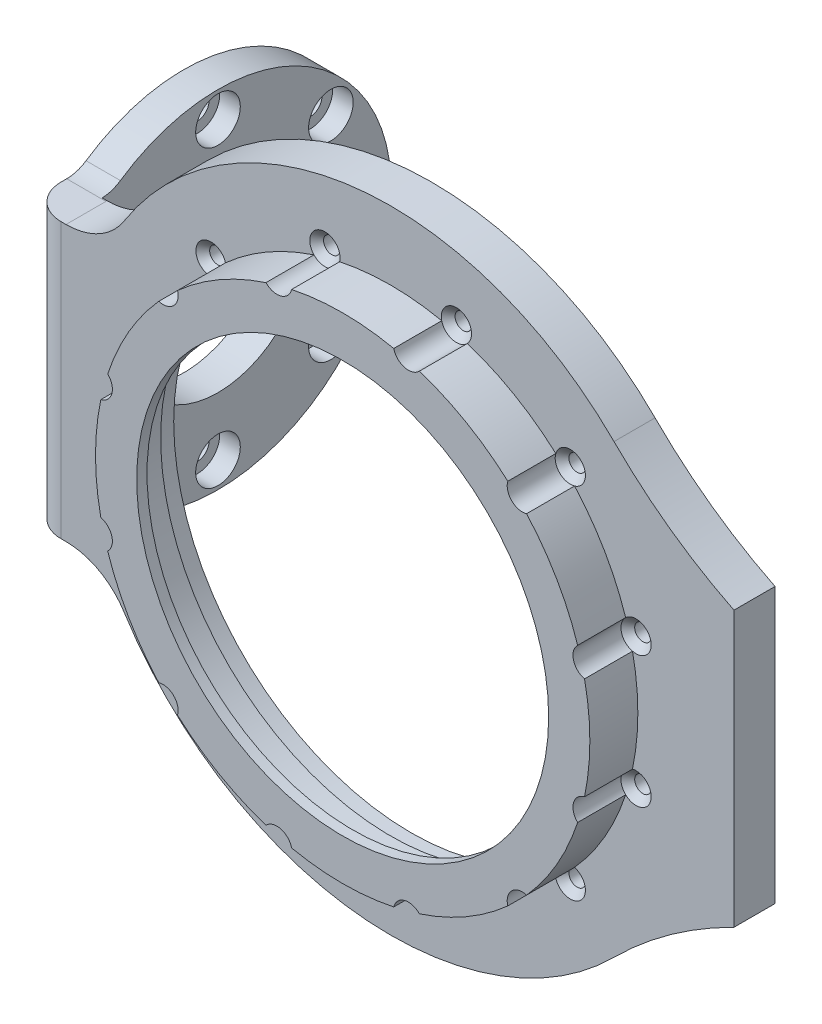
from build123d import *

# Parameters (mm, degrees)
SKETCH_3_R                   = 46
SKETCH_3_R_2                 = 34.6
EXTRUDE_2_DEPTH              = 3
SKETCH_5_R                   = 36
SKETCH_5_R_2                 = 33.5
EXTRUDE_3_DEPTH              = 5.49
EXTRUDE_START                = -2.98
SKETCH_2_R                   = 46
SKETCH_2_R_2                 = 41.6
EXTRUDE_1_DEPTH              = 2.98
SKETCH_6_R                   = 36
SKETCH_6_R_2                 = 30
EXTRUDE_4_DEPTH              = 1.5
EXTRUDE_5_DEPTH              = 3
EXTRUDE_5_DEPTH_BACK         = 2.98
HOLE_WIZARD_M2_1_AT_2_COUNT  = 2
HOLE_WIZARD_M2_1_AT_2_PITCH  = 64.085879878
HOLE_WIZARD_M2_1_AT_3_COUNT  = 2
HOLE_WIZARD_M2_1_AT_3_PITCH  = 71.478511138
HOLE_WIZARD_M2_1_AT_4_COUNT  = 2
HOLE_WIZARD_M2_1_AT_4_PITCH  = 73.999999995
HOLE_WIZARD_M2_1_AT_5_COUNT  = 2
HOLE_WIZARD_M2_1_AT_5_PITCH  = 19.15260934
HOLE_WIZARD_M2_1_AT_6_COUNT  = 2
HOLE_WIZARD_M2_1_AT_6_PITCH  = 36.999999998
HOLE_WIZARD_M2_1_AT_7_COUNT  = 2
HOLE_WIZARD_M2_1_AT_7_PITCH  = 52.325901805
HOLE_WIZARD_M2_1_AT_8_COUNT  = 2
HOLE_WIZARD_M2_1_AT_8_PITCH  = 71.47851114
HOLE_WIZARD_M2_1_AT_9_COUNT  = 2
HOLE_WIZARD_M2_1_AT_9_PITCH  = 64.085879872
HOLE_WIZARD_M2_1_AT_10_COUNT = 2
HOLE_WIZARD_M2_1_AT_10_PITCH = 52.325901805
HOLE_WIZARD_M2_1_AT_11_COUNT = 2
HOLE_WIZARD_M2_1_AT_11_PITCH = 36.999999994
HOLE_WIZARD_M2_1_AT_12_COUNT = 2
HOLE_WIZARD_M2_1_AT_12_PITCH = 19.152609334
CUT_EXTRUDE_1_REACH          = 70.3
SKETCH_13_R                  = 2.2
EXTRUDE_6_DEPTH              = 3
EXTRUDE_6_DEPTH_BACK         = 2
FILLET_1_R                   = 10
FILLET_2_R                   = 10
FILLET_3_R                   = 5
FILLET_4_R                   = 5
FILLET_5_R                   = 5
CUT_EXTRUDE_3_DEPTH          = 119.953814567
CUT_EXTRUDE_3_DEPTH_BACK     = 119.953814567
SKETCH_19_R                  = 13
HOLE_WIZARD_M3_1_AT_2_COUNT  = 2
HOLE_WIZARD_M3_1_AT_2_PITCH  = 18.144210967
HOLE_WIZARD_M3_1_AT_3_COUNT  = 2
HOLE_WIZARD_M3_1_AT_3_PITCH  = 18.144210967
HOLE_WIZARD_M3_1_AT_4_COUNT  = 2
HOLE_WIZARD_M3_1_AT_4_PITCH  = 38.910385988
HOLE_WIZARD_M3_1_AT_5_COUNT  = 2
HOLE_WIZARD_M3_1_AT_5_PITCH  = 42.932860717
HOLE_WIZARD_M3_1_AT_6_COUNT  = 2
HOLE_WIZARD_M3_1_AT_6_PITCH  = 38.910385988
CUT_EXTRUDE_START            = -15
SKETCH_21_R                  = 3.25
CUT_EXTRUDE_4_DEPTH          = 15


with BuildPart() as part:
    # 草图3 → 凸台-拉伸2 (new body)
    with BuildSketch(Plane.XY):
        Circle(SKETCH_3_R)
        Circle(SKETCH_3_R_2, mode=Mode.SUBTRACT)
    extrude(amount=EXTRUDE_2_DEPTH)

    # 草图5 → 凸台-拉伸3 (add)
    with BuildSketch(Plane.XY.offset(3)):
        Circle(SKETCH_5_R)
        Circle(SKETCH_5_R_2, mode=Mode.SUBTRACT)
    extrude(amount=EXTRUDE_3_DEPTH)

    # 草图2 → 凸台-拉伸1 (add)
    with BuildSketch(Plane.XY.offset(EXTRUDE_START)):
        Circle(SKETCH_2_R)
        Circle(SKETCH_2_R_2, mode=Mode.SUBTRACT)
    extrude(amount=EXTRUDE_1_DEPTH)

    # 草图6 → 凸台-拉伸4 (add)
    with BuildSketch(Plane.XY.offset(8.49)):
        Circle(SKETCH_6_R)
        Circle(SKETCH_6_R_2, mode=Mode.SUBTRACT)
    extrude(amount=EXTRUDE_4_DEPTH)

    # 草图8 → 凸台-拉伸5 (add, two sides: drawn at the far end of the back side and taken through both)
    with BuildSketch(Plane.XY.offset(-EXTRUDE_5_DEPTH_BACK)):
        with BuildLine():
            Line((-50, -20), (-50, 20))
            Line((-50, 20), (-41.424630354, 20))
            ThreePointArc((-41.424630354, 20), (-46, 0), (-41.424630354, -20))
            Line((-41.424630354, -20), (-50, -20))
        make_face()
        with BuildLine():
            Line((50, -20), (50, 20))
            ThreePointArc((50, 20), (40.750582015, 25.548076808), (32.526911935, 32.526911935))
            ThreePointArc((32.526911935, 32.526911935), (46, 0), (32.526911935, -32.526911935))
            ThreePointArc((32.526911935, -32.526911935), (40.750582015, -25.548076808), (50, -20))
        make_face()
    extrude(amount=EXTRUDE_5_DEPTH + EXTRUDE_5_DEPTH_BACK)

    # 草图12 → M2 锥坑平头的锥孔1 (revolve, cut)
    with BuildSketch(Plane(origin=(-35.73925557, -9.57630467, 3), x_dir=(0, -1, 0), z_dir=(1, 0, 0))):
        Polygon((0, 0), (0, 5.98), (1.2, 5.98), (1.2, 1), (2.2, 0), align=None)
    hole_wizard_m2_1 = revolve(axis=Axis((-35.73925557, -9.57630467, 9.35), (0, 0, -1)), mode=Mode.SUBTRACT)

    # M2 锥坑平头的锥孔1 at 2: M2 锥坑平头的锥孔1 ×2
    with Locations(*[Vector(0.7071067811865475, 0.7071067811865476, 0) * (i * HOLE_WIZARD_M2_1_AT_2_PITCH) for i in range(1, HOLE_WIZARD_M2_1_AT_2_COUNT)]):
        add(hole_wizard_m2_1, mode=Mode.SUBTRACT)

    # M2 锥坑平头的锥孔1 at 3: M2 锥坑平头的锥孔1 ×2
    with Locations(*[Vector(0.8660254037776919, 0.500000000011686, 0) * (i * HOLE_WIZARD_M2_1_AT_3_PITCH) for i in range(1, HOLE_WIZARD_M2_1_AT_3_COUNT)]):
        add(hole_wizard_m2_1, mode=Mode.SUBTRACT)

    # M2 锥坑平头的锥孔1 at 4: M2 锥坑平头的锥孔1 ×2
    with Locations(*[Vector(0.9659258262760346, 0.2588190451511635, 0) * (i * HOLE_WIZARD_M2_1_AT_4_PITCH) for i in range(1, HOLE_WIZARD_M2_1_AT_4_COUNT)]):
        add(hole_wizard_m2_1, mode=Mode.SUBTRACT)

    # M2 锥坑平头的锥孔1 at 5: M2 锥坑平头的锥孔1 ×2
    with Locations(*[(0, i * HOLE_WIZARD_M2_1_AT_5_PITCH, 0) for i in range(1, HOLE_WIZARD_M2_1_AT_5_COUNT)]):
        add(hole_wizard_m2_1, mode=Mode.SUBTRACT)

    # M2 锥坑平头的锥孔1 at 6: M2 锥坑平头的锥孔1 ×2
    with Locations(*[Vector(0.25881904515116333, 0.9659258262760346, 0) * (i * HOLE_WIZARD_M2_1_AT_6_PITCH) for i in range(1, HOLE_WIZARD_M2_1_AT_6_COUNT)]):
        add(hole_wizard_m2_1, mode=Mode.SUBTRACT)

    # M2 锥坑平头的锥孔1 at 7: M2 锥坑平头的锥孔1 ×2
    with Locations(*[Vector(0.4999999999563881, 0.866025403809618, 0) * (i * HOLE_WIZARD_M2_1_AT_7_PITCH) for i in range(1, HOLE_WIZARD_M2_1_AT_7_COUNT)]):
        add(hole_wizard_m2_1, mode=Mode.SUBTRACT)

    # M2 锥坑平头的锥孔1 at 8: M2 锥坑平头的锥孔1 ×2
    with Locations(*[(i * HOLE_WIZARD_M2_1_AT_8_PITCH, 0, 0) for i in range(1, HOLE_WIZARD_M2_1_AT_8_COUNT)]):
        add(hole_wizard_m2_1, mode=Mode.SUBTRACT)

    # M2 锥坑平头的锥孔1 at 9: M2 锥坑平头的锥孔1 ×2
    with Locations(*[Vector(0.9659258263021021, -0.2588190450538782, 0) * (i * HOLE_WIZARD_M2_1_AT_9_PITCH) for i in range(1, HOLE_WIZARD_M2_1_AT_9_COUNT)]):
        add(hole_wizard_m2_1, mode=Mode.SUBTRACT)

    # M2 锥坑平头的锥孔1 at 10: M2 锥坑平头的锥孔1 ×2
    with Locations(*[Vector(0.8660254038096179, -0.4999999999563883, 0) * (i * HOLE_WIZARD_M2_1_AT_10_PITCH) for i in range(1, HOLE_WIZARD_M2_1_AT_10_COUNT)]):
        add(hole_wizard_m2_1, mode=Mode.SUBTRACT)

    # M2 锥坑平头的锥孔1 at 11: M2 锥坑平头的锥孔1 ×2
    with Locations(*[Vector(0.7071067811865475, -0.7071067811865477, 0) * (i * HOLE_WIZARD_M2_1_AT_11_PITCH) for i in range(1, HOLE_WIZARD_M2_1_AT_11_COUNT)]):
        add(hole_wizard_m2_1, mode=Mode.SUBTRACT)

    # M2 锥坑平头的锥孔1 at 12: M2 锥坑平头的锥孔1 ×2
    with Locations(*[Vector(0.5000000001627614, -0.8660254036904684, 0) * (i * HOLE_WIZARD_M2_1_AT_12_PITCH) for i in range(1, HOLE_WIZARD_M2_1_AT_12_COUNT)]):
        add(hole_wizard_m2_1, mode=Mode.SUBTRACT)

    # 草图13 → 切除-拉伸1 (cut, up to next)
    with BuildSketch(Plane.XY.offset(3), mode=Mode.PRIVATE) as cut_extrude_1_sk1:
        with Locations((-35.73925557, -9.57630467)):
            Circle(SKETCH_13_R)
    cut_extrude_1_tool1 = extrude(cut_extrude_1_sk1.sketch, amount=CUT_EXTRUDE_1_REACH, mode=Mode.PRIVATE) & part.part
    # 草图13 → 切除-拉伸1 (cut, up to next)
    with BuildSketch(Plane.XY.offset(3), mode=Mode.PRIVATE) as cut_extrude_1_sk2:
        with Locations((-26.1629509, -26.1629509)):
            Circle(SKETCH_13_R)
    cut_extrude_1_tool2 = extrude(cut_extrude_1_sk2.sketch, amount=CUT_EXTRUDE_1_REACH, mode=Mode.PRIVATE) & part.part
    # 草图13 → 切除-拉伸1 (cut, up to next)
    with BuildSketch(Plane.XY.offset(3), mode=Mode.PRIVATE) as cut_extrude_1_sk3:
        with Locations((-35.73925557, 9.57630467)):
            Circle(SKETCH_13_R)
    cut_extrude_1_tool3 = extrude(cut_extrude_1_sk3.sketch, amount=CUT_EXTRUDE_1_REACH, mode=Mode.PRIVATE) & part.part
    # 草图13 → 切除-拉伸1 (cut, up to next)
    with BuildSketch(Plane.XY.offset(3), mode=Mode.PRIVATE) as cut_extrude_1_sk4:
        with Locations((-26.1629509, 26.1629509)):
            Circle(SKETCH_13_R)
    cut_extrude_1_tool4 = extrude(cut_extrude_1_sk4.sketch, amount=CUT_EXTRUDE_1_REACH, mode=Mode.PRIVATE) & part.part
    # 草图13 → 切除-拉伸1 (cut, up to next)
    with BuildSketch(Plane.XY.offset(3), mode=Mode.PRIVATE) as cut_extrude_1_sk5:
        with Locations((-9.57630467, 35.73925557)):
            Circle(SKETCH_13_R)
    cut_extrude_1_tool5 = extrude(cut_extrude_1_sk5.sketch, amount=CUT_EXTRUDE_1_REACH, mode=Mode.PRIVATE) & part.part
    # 草图13 → 切除-拉伸1 (cut, up to next)
    with BuildSketch(Plane.XY.offset(3), mode=Mode.PRIVATE) as cut_extrude_1_sk6:
        with Locations((26.1629509, 26.1629509)):
            Circle(SKETCH_13_R)
    cut_extrude_1_tool6 = extrude(cut_extrude_1_sk6.sketch, amount=CUT_EXTRUDE_1_REACH, mode=Mode.PRIVATE) & part.part
    # 草图13 → 切除-拉伸1 (cut, up to next)
    with BuildSketch(Plane.XY.offset(3), mode=Mode.PRIVATE) as cut_extrude_1_sk7:
        with Locations((35.73925557, 9.57630467)):
            Circle(SKETCH_13_R)
    cut_extrude_1_tool7 = extrude(cut_extrude_1_sk7.sketch, amount=CUT_EXTRUDE_1_REACH, mode=Mode.PRIVATE) & part.part
    # 草图13 → 切除-拉伸1 (cut, up to next)
    with BuildSketch(Plane.XY.offset(3), mode=Mode.PRIVATE) as cut_extrude_1_sk8:
        with Locations((35.73925557, -9.57630467)):
            Circle(SKETCH_13_R)
    cut_extrude_1_tool8 = extrude(cut_extrude_1_sk8.sketch, amount=CUT_EXTRUDE_1_REACH, mode=Mode.PRIVATE) & part.part
    # 草图13 → 切除-拉伸1 (cut, up to next)
    with BuildSketch(Plane.XY.offset(3), mode=Mode.PRIVATE) as cut_extrude_1_sk9:
        with Locations((9.57630467, -35.73925557)):
            Circle(SKETCH_13_R)
    cut_extrude_1_tool9 = extrude(cut_extrude_1_sk9.sketch, amount=CUT_EXTRUDE_1_REACH, mode=Mode.PRIVATE) & part.part
    # 草图13 → 切除-拉伸1 (cut, up to next)
    with BuildSketch(Plane.XY.offset(3), mode=Mode.PRIVATE) as cut_extrude_1_sk10:
        with Locations((-9.57630467, -35.73925557)):
            Circle(SKETCH_13_R)
    cut_extrude_1_tool10 = extrude(cut_extrude_1_sk10.sketch, amount=CUT_EXTRUDE_1_REACH, mode=Mode.PRIVATE) & part.part
    # 草图13 → 切除-拉伸1 (cut, up to next)
    with BuildSketch(Plane.XY.offset(3), mode=Mode.PRIVATE) as cut_extrude_1_sk11:
        with Locations((9.57630467, 35.73925557)):
            Circle(SKETCH_13_R)
    cut_extrude_1_tool11 = extrude(cut_extrude_1_sk11.sketch, amount=CUT_EXTRUDE_1_REACH, mode=Mode.PRIVATE) & part.part
    # 草图13 → 切除-拉伸1 (cut, up to next)
    with BuildSketch(Plane.XY.offset(3), mode=Mode.PRIVATE) as cut_extrude_1_sk12:
        with Locations((26.1629509, -26.1629509)):
            Circle(SKETCH_13_R)
    cut_extrude_1_tool12 = extrude(cut_extrude_1_sk12.sketch, amount=CUT_EXTRUDE_1_REACH, mode=Mode.PRIVATE) & part.part
    add(cut_extrude_1_tool1.solids().sort_by_distance((-35.739256, -9.576305, 3))[0], mode=Mode.SUBTRACT)
    add(cut_extrude_1_tool2.solids().sort_by_distance((-26.162951, -26.162951, 3))[0], mode=Mode.SUBTRACT)
    add(cut_extrude_1_tool3.solids().sort_by_distance((-35.739256, 9.576305, 3))[0], mode=Mode.SUBTRACT)
    add(cut_extrude_1_tool4.solids().sort_by_distance((-26.162951, 26.162951, 3))[0], mode=Mode.SUBTRACT)
    add(cut_extrude_1_tool5.solids().sort_by_distance((-9.576305, 35.739256, 3))[0], mode=Mode.SUBTRACT)
    add(cut_extrude_1_tool6.solids().sort_by_distance((26.162951, 26.162951, 3))[0], mode=Mode.SUBTRACT)
    add(cut_extrude_1_tool7.solids().sort_by_distance((35.739256, 9.576305, 3))[0], mode=Mode.SUBTRACT)
    add(cut_extrude_1_tool8.solids().sort_by_distance((35.739256, -9.576305, 3))[0], mode=Mode.SUBTRACT)
    add(cut_extrude_1_tool9.solids().sort_by_distance((9.576305, -35.739256, 3))[0], mode=Mode.SUBTRACT)
    add(cut_extrude_1_tool10.solids().sort_by_distance((-9.576305, -35.739256, 3))[0], mode=Mode.SUBTRACT)
    add(cut_extrude_1_tool11.solids().sort_by_distance((9.576305, 35.739256, 3))[0], mode=Mode.SUBTRACT)
    add(cut_extrude_1_tool12.solids().sort_by_distance((26.162951, -26.162951, 3))[0], mode=Mode.SUBTRACT)

    # 草图14 → 凸台-拉伸6 (add, two sides: drawn at the far end of the back side and taken through both)
    with BuildSketch(Plane.ZY.offset(50).offset(-EXTRUDE_6_DEPTH_BACK)):
        with BuildLine():
            Line((-4.436937358, 20), (3, 20))
            Line((3, 20), (3, -20))
            Line((3, -20), (-4.436937358, -20))
            ThreePointArc((-4.436937358, -20), (-45.1, 0), (-4.436937358, 20))
        make_face()
    extrude(amount=EXTRUDE_6_DEPTH + EXTRUDE_6_DEPTH_BACK)

    # 圆角1
    fillet_1_edges = [part.edges().sort_by_distance(p)[0] for p in [
        (-41.424630354, 20, 0.01),
    ]]
    fillet(fillet_1_edges, radius=FILLET_1_R)

    # 圆角2
    fillet_2_edges = [part.edges().sort_by_distance(p)[0] for p in [
        (-41.424630354, -20, 0.01),
    ]]
    fillet(fillet_2_edges, radius=FILLET_2_R)

    # 圆角3
    # the kernel refuses this fillet: 5 mm, written as the material it adds along each edge
    with BuildSketch(Plane(origin=(-43.954603279, 20, -4.436937358), x_dir=(0, 0, 1), z_dir=(-1, 0, 0))) as fillet_3_piece_1_section:
        with BuildLine():
            CenterArc((1.618158688, 5), FILLET_3_R, 235.735397106, 34.264602894)
            ThreePointArc((-1.196919217, 0.867768595), (-0.592107254, 0.442646144), (0, 0))
            Line((0, 0), (1.618158688, 0))
        make_face()
    fillet_3_piece_1 = extrude(amount=9.045396721, mode=Mode.PRIVATE)
    fillet_3_piece_1 = split(fillet_3_piece_1, bisect_by=Plane(origin=(-47.698017954, 20.000730506, -2.98), z_dir=(0, 0, 1)), keep=Keep.TOP, mode=Mode.PRIVATE)
    fillet_3_piece_1 = fillet_3_piece_1 - Plane(origin=(-47.28636167, 30, -2.938164072), x_dir=(0.8443993155383497, -0.5357142857142851, 0), z_dir=(0, 0, 1)) * Cylinder(10, 25, mode=Mode.PRIVATE)
    add(fillet_3_piece_1)
    with BuildSketch(Plane(origin=(-48, 20, -4.436937358), x_dir=(0, 0, 1), z_dir=(-1, 0, 0))) as fillet_3_piece_2:
        with BuildLine():
            CenterArc((1.618158688, 5), FILLET_3_R, 235.735397106, 34.264602894)
            ThreePointArc((-1.196919217, 0.867768595), (-0.592107254, 0.442646144), (0, 0))
            Line((0, 0), (1.618158688, 0))
        make_face()
    extrude(amount=5)

    # 圆角4
    fillet_4_edges = [part.edges().sort_by_distance(p)[0] for p in [
        (-53, 0, 3),
    ]]
    fillet(fillet_4_edges, radius=FILLET_4_R)

    # 圆角5
    # the kernel refuses this fillet: 5 mm, written as the material it adds along each edge
    with BuildSketch(Plane(origin=(-43.954603279, -20, -4.436937358), x_dir=(0, 0, 1), z_dir=(-1, 0, 0))) as fillet_5_piece_1_section:
        with BuildLine():
            CenterArc((1.618158688, -5), FILLET_5_R, 90, 34.264602894)
            ThreePointArc((-1.196919217, -0.867768595), (-0.592107254, -0.442646144), (0, 0))
            Line((0, 0), (1.618158688, 0))
        make_face()
    fillet_5_piece_1 = extrude(amount=9.045396721, mode=Mode.PRIVATE)
    fillet_5_piece_1 = fillet_5_piece_1 - Plane(origin=(-47.28636167, -30, -2.938164073), x_dir=(0, 1, 0), z_dir=(0, 0, -1)) * Cylinder(10, 25, mode=Mode.PRIVATE)
    fillet_5_piece_1 = split(fillet_5_piece_1, bisect_by=Plane(origin=(-47.698017954, -20.000730506, -2.98), z_dir=(0, 0, 1)), keep=Keep.TOP, mode=Mode.PRIVATE)
    add(fillet_5_piece_1)
    with BuildSketch(Plane(origin=(-48, -20, -4.436937358), x_dir=(0, 0, 1), z_dir=(-1, 0, 0))) as fillet_5_piece_2:
        with BuildLine():
            CenterArc((1.618158688, -5), FILLET_5_R, 90, 34.264602894)
            ThreePointArc((-1.196919217, -0.867768595), (-0.592107254, -0.442646144), (0, 0))
            Line((0, 0), (1.618158688, 0))
        make_face()
    extrude(amount=5)

    # 草图19 → 切除-拉伸3 (cut, two sides: drawn at the far end of the back side and taken through both)
    with BuildSketch(Plane.ZY.offset(50).offset(-CUT_EXTRUDE_3_DEPTH_BACK)):
        with Locations((-19.85, 0)):
            Circle(SKETCH_19_R)
    extrude(amount=CUT_EXTRUDE_3_DEPTH + CUT_EXTRUDE_3_DEPTH_BACK, mode=Mode.SUBTRACT)

    # 草图20 → M3 六角凹头盖的柱孔1 (revolve, cut)
    with BuildSketch(Plane(origin=(-48, 21.466430357, -19.85), x_dir=(0, 0, -1), z_dir=(0, 1, 0))):
        Polygon((0, 0), (0, 5), (1.7, 5), (1.7, 3), (3.25, 3), (3.25, 0), align=None)
    hole_wizard_m3_1 = revolve(axis=Axis((-41.65, 21.466430357, -19.85), (-1, 0, 0)), mode=Mode.SUBTRACT)

    # M3 六角凹头盖的柱孔1 at 2: M3 六角凹头盖的柱孔1 ×2
    with Locations(*[Vector(0, -0.42261826174070016, -0.9063077870366497) * (i * HOLE_WIZARD_M3_1_AT_2_PITCH) for i in range(1, HOLE_WIZARD_M3_1_AT_2_COUNT)]):
        add(hole_wizard_m3_1, mode=Mode.SUBTRACT)

    # M3 六角凹头盖的柱孔1 at 3: M3 六角凹头盖的柱孔1 ×2
    with Locations(*[Vector(0, -0.4226182616258053, 0.9063077870902261) * (i * HOLE_WIZARD_M3_1_AT_3_PITCH) for i in range(1, HOLE_WIZARD_M3_1_AT_3_COUNT)]):
        add(hole_wizard_m3_1, mode=Mode.SUBTRACT)

    # M3 六角凹头盖的柱孔1 at 4: M3 六角凹头盖的柱孔1 ×2
    with Locations(*[Vector(0, -0.9063077870353761, -0.42261826174343137) * (i * HOLE_WIZARD_M3_1_AT_4_PITCH) for i in range(1, HOLE_WIZARD_M3_1_AT_4_COUNT)]):
        add(hole_wizard_m3_1, mode=Mode.SUBTRACT)

    # M3 六角凹头盖的柱孔1 at 5: M3 六角凹头盖的柱孔1 ×2
    with Locations(*[(0, -i * HOLE_WIZARD_M3_1_AT_5_PITCH, 0) for i in range(1, HOLE_WIZARD_M3_1_AT_5_COUNT)]):
        add(hole_wizard_m3_1, mode=Mode.SUBTRACT)

    # M3 六角凹头盖的柱孔1 at 6: M3 六角凹头盖的柱孔1 ×2
    with Locations(*[Vector(0, -0.9063077870353761, 0.42261826174343153) * (i * HOLE_WIZARD_M3_1_AT_6_PITCH) for i in range(1, HOLE_WIZARD_M3_1_AT_6_COUNT)]):
        add(hole_wizard_m3_1, mode=Mode.SUBTRACT)

    # 草图21 → 切除-拉伸4 (cut)
    with BuildSketch(Plane.ZY.offset(50).offset(CUT_EXTRUDE_START)):
        with Locations(Location((-3.40576031, 13.79835546, 0), (0, 0, 180))):
            Circle(SKETCH_21_R)
        with Locations(Location((-3.40576031, -13.79835546, 0), (0, 0, 180))):
            Circle(SKETCH_21_R)
    extrude(amount=CUT_EXTRUDE_4_DEPTH, mode=Mode.SUBTRACT)


solid = part.part
